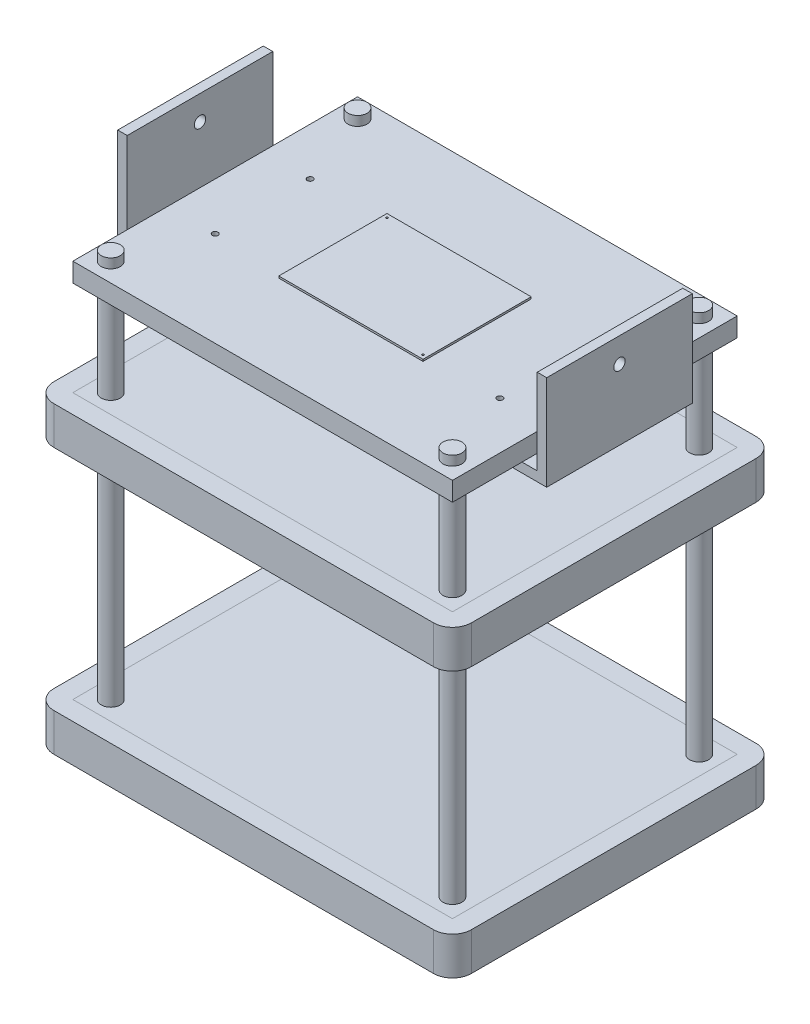
from build123d import *

# Parameters (mm, degrees)
SKETCH1_W            = 200
SKETCH1_H            = 150
BOSS_EXTRUDE1_DEPTH  = 10
SKETCH2_R            = 5
CUT_EXTRUDE1_DEPTH   = 10
SKETCH3_W            = 200
SKETCH3_H            = 150
SKETCH3_R            = 5
BOSS_EXTRUDE2_DEPTH  = 10
SKETCH4_W            = 200
SKETCH4_H            = 150
SKETCH4_R            = 5
BOSS_EXTRUDE3_DEPTH  = 10
BOSS_EXTRUDE13_START = 205
SKETCH21_R           = 5
BOSS_EXTRUDE13_DEPTH = 205
SKETCH22_R           = 5
BOSS_EXTRUDE14_DEPTH = 15
SKETCH23_R           = 1.5
CUT_EXTRUDE2_DEPTH   = 10
SKETCH27_W           = 76
SKETCH27_H           = 57
BOSS_EXTRUDE16_DEPTH = 1
SKETCH30_R           = 0.5
CUT_EXTRUDE3_DEPTH   = 30
SKETCH35_W           = 220
SKETCH35_H           = 170
SKETCH35_W_2         = 200
SKETCH35_H_2         = 150
BOSS_EXTRUDE19_DEPTH = 10
FILLET4_R            = 10
SKETCH39_W           = 220
SKETCH39_H           = 170
SKETCH39_W_2         = 200
SKETCH39_H_2         = 150
BOSS_EXTRUDE20_DEPTH = 10
FILLET5_R            = 10
SKETCH42_W           = 15
SKETCH42_H           = 20
SKETCH42_W_2         = 25
SKETCH42_H_2         = 50
SKETCH42_W_3         = 43.3
SKETCH42_H_3         = 43.3
BOSS_EXTRUDE23_DEPTH = 1
SKETCH46_W           = 30
SKETCH46_H           = 76.670556204
BOSS_EXTRUDE24_DEPTH = 5
SKETCH48_W           = 76.670556204
SKETCH48_H           = 50
BOSS_EXTRUDE25_DEPTH = 5
SKETCH49_R           = 3
CUT_EXTRUDE4_DEPTH   = 5
SKETCH54_W           = 76.670556204
SKETCH54_H           = 50
BOSS_EXTRUDE26_DEPTH = 5
CUT_EXTRUDE5_START   = -5
SKETCH55_R           = 3
CUT_EXTRUDE5_DEPTH   = 5


with BuildPart() as part:
    # Sketch1 → Boss-Extrude1 (new body)
    with BuildSketch(Plane(origin=(0, 0, 0), x_dir=(1, 0, 0), z_dir=(0, 1, 0))):
        Rectangle(SKETCH1_W, SKETCH1_H)
    extrude(amount=BOSS_EXTRUDE1_DEPTH)

    # Sketch2 → Cut-Extrude1 (cut)
    with BuildSketch(Plane(origin=(0, 10, 0), x_dir=(1, 0, 0), z_dir=(0, 1, 0))):
        with Locations((-90, 65)):
            Circle(SKETCH2_R)
        with Locations((90, 65)):
            Circle(SKETCH2_R)
        with Locations((90, -65)):
            Circle(SKETCH2_R)
        with Locations((-90, -65)):
            Circle(SKETCH2_R)
    extrude(amount=-CUT_EXTRUDE1_DEPTH, mode=Mode.SUBTRACT)



with BuildPart() as body_2:
    # Sketch3 → Boss-Extrude2 (new body)
    with BuildSketch(Plane(origin=(0, 140, 0), x_dir=(1, 0, 0), z_dir=(0, 1, 0))):
        Rectangle(SKETCH3_W, SKETCH3_H)
        with Locations((-90, 65)):
            Circle(SKETCH3_R, mode=Mode.SUBTRACT)
        with Locations((90, 65)):
            Circle(SKETCH3_R, mode=Mode.SUBTRACT)
        with Locations((-90, -65)):
            Circle(SKETCH3_R, mode=Mode.SUBTRACT)
        with Locations((90, -65)):
            Circle(SKETCH3_R, mode=Mode.SUBTRACT)
    extrude(amount=BOSS_EXTRUDE2_DEPTH)



with BuildPart() as body_3:
    # Sketch4 → Boss-Extrude3 (new body)
    with BuildSketch(Plane(origin=(0, 200, 0), x_dir=(1, 0, 0), z_dir=(0, 1, 0))):
        Rectangle(SKETCH4_W, SKETCH4_H)
        with Locations((-90, 65)):
            Circle(SKETCH4_R, mode=Mode.SUBTRACT)
        with Locations((90, 65)):
            Circle(SKETCH4_R, mode=Mode.SUBTRACT)
        with Locations((90, -65)):
            Circle(SKETCH4_R, mode=Mode.SUBTRACT)
        with Locations((-90, -65)):
            Circle(SKETCH4_R, mode=Mode.SUBTRACT)
    extrude(amount=BOSS_EXTRUDE3_DEPTH)


with BuildPart() as body_2_1:
    add(body_2.part)

    add(body_3.part)  # Boss-Extrude13 merges body 3
    # Sketch21 → Boss-Extrude13 (add)
    with BuildSketch(Plane(origin=(0, 10, 0), x_dir=(1, 0, 0), z_dir=(0, 1, 0)).offset(BOSS_EXTRUDE13_START)):
        with Locations((-90, -65)):
            Circle(SKETCH21_R)
        with Locations((-90, 65)):
            Circle(SKETCH21_R)
        with Locations((90, 65)):
            Circle(SKETCH21_R)
        with Locations((90, -65)):
            Circle(SKETCH21_R)
    extrude(amount=-BOSS_EXTRUDE13_DEPTH)


with BuildPart() as part_1:
    add(part.part)

    add(body_2_1.part)  # Boss-Extrude14 merges body 2
    # Sketch22 → Boss-Extrude14 (add)
    with BuildSketch(Plane(origin=(0, 10, 0), x_dir=(1, 0, 0), z_dir=(0, 1, 0))):
        with Locations((-90, 65)):
            Circle(SKETCH22_R)
        with Locations((-90, -65)):
            Circle(SKETCH22_R)
        with Locations((90, -65)):
            Circle(SKETCH22_R)
        with Locations((90, 65)):
            Circle(SKETCH22_R)
    extrude(amount=-BOSS_EXTRUDE14_DEPTH)

    # Sketch23 → Cut-Extrude2 (cut)
    with BuildSketch(Plane(origin=(0, 210, 0), x_dir=(1, 0, 0), z_dir=(0, 1, 0))):
        with Locations((-75, 25)):
            Circle(SKETCH23_R)
        with Locations((-75, -25)):
            Circle(SKETCH23_R)
        with Locations((75, -25)):
            Circle(SKETCH23_R)
        with Locations((75, 25)):
            Circle(SKETCH23_R)
    extrude(amount=-CUT_EXTRUDE2_DEPTH, mode=Mode.SUBTRACT)

    # Sketch27 → Boss-Extrude16 (add)
    with BuildSketch(Plane(origin=(0, 210, 0), x_dir=(1, 0, 0), z_dir=(0, 1, 0))):
        Rectangle(SKETCH27_W, SKETCH27_H)
    extrude(amount=BOSS_EXTRUDE16_DEPTH)

    # Sketch30 → Cut-Extrude3 (cut)
    with BuildSketch(Plane(origin=(0, 211, 0), x_dir=(1, 0, 0), z_dir=(0, 1, 0))):
        with Locations((-36, 26.5)):
            Circle(SKETCH30_R)
        with Locations((36, -26.5)):
            Circle(SKETCH30_R)
    extrude(amount=-CUT_EXTRUDE3_DEPTH, mode=Mode.SUBTRACT)

    # Sketch42 → Boss-Extrude23 (add)
    with BuildSketch(Plane.XZ.offset(-200)):
        Rectangle(SKETCH42_W, SKETCH42_H)
        with Locations((-58.240305189, 7.803312526)):
            Rectangle(SKETCH42_W_2, SKETCH42_H_2)
        with Locations((37.35, 2.211754737)):
            Rectangle(SKETCH42_W_3, SKETCH42_H_3)
    extrude(amount=BOSS_EXTRUDE23_DEPTH)

    # Sketch46 → Boss-Extrude24 (add)
    with BuildSketch(Plane(origin=(0, 200, 0), x_dir=(-1, 0, 0), z_dir=(0, -1, 0))):
        with Locations((-93, 0)):
            Rectangle(SKETCH46_W, SKETCH46_H)
        with Locations((93, 0)):
            Rectangle(SKETCH46_W, SKETCH46_H)
    extrude(amount=BOSS_EXTRUDE24_DEPTH)

    # Sketch48 → Boss-Extrude25 (add)
    with BuildSketch(Plane.ZY.offset(108)):
        with Locations((0, 220)):
            Rectangle(SKETCH48_W, SKETCH48_H)
    extrude(amount=BOSS_EXTRUDE25_DEPTH)

    # Sketch49 → Cut-Extrude4 (cut)
    with BuildSketch(Plane.ZY.offset(113)):
        with Locations((0, 232)):
            Circle(SKETCH49_R)
    extrude(amount=-CUT_EXTRUDE4_DEPTH, mode=Mode.SUBTRACT)

    # Sketch54 → Boss-Extrude26 (add)
    with BuildSketch(Plane(origin=(108, 0, 0), x_dir=(0, 0, -1), z_dir=(1, 0, 0))):
        with Locations((0, 220)):
            Rectangle(SKETCH54_W, SKETCH54_H)
    extrude(amount=BOSS_EXTRUDE26_DEPTH)

    # Sketch55 → Cut-Extrude5 (cut)
    with BuildSketch(Plane(origin=(113, 0, 0), x_dir=(0, 0, -1), z_dir=(1, 0, 0)).offset(CUT_EXTRUDE5_START)):
        with Locations((0, 232)):
            Circle(SKETCH55_R)
    extrude(amount=CUT_EXTRUDE5_DEPTH, mode=Mode.SUBTRACT)


with BuildPart() as body_2_2:
    # Sketch35 → Boss-Extrude19 (new, symmetric)
    with BuildSketch(Plane(origin=(0, 0, 0), x_dir=(-1, 0, 0), z_dir=(0, -1, 0))):
        Rectangle(SKETCH35_W, SKETCH35_H)
        Rectangle(SKETCH35_W_2, SKETCH35_H_2, mode=Mode.SUBTRACT)
    extrude(amount=BOSS_EXTRUDE19_DEPTH, both=True)

    # Fillet4
    fillet4_edges = [body_2_2.edges().sort_by_distance(p)[0] for p in [
        (110, 0, 85),
        (110, 0, -85),
        (-110, 0, 85),
        (-110, 0, -85),
    ]]
    fillet(fillet4_edges, radius=FILLET4_R)


with BuildPart() as body_3_2:
    # Sketch39 → Boss-Extrude20 (new, symmetric)
    with BuildSketch(Plane.XZ.offset(-140)):
        Rectangle(SKETCH39_W, SKETCH39_H)
        Rectangle(SKETCH39_W_2, SKETCH39_H_2, mode=Mode.SUBTRACT)
    extrude(amount=BOSS_EXTRUDE20_DEPTH, both=True)

    # Fillet5
    fillet5_edges = [body_3_2.edges().sort_by_distance(p)[0] for p in [
        (110, 140, 85),
        (110, 140, -85),
        (-110, 140, -85),
        (-110, 140, 85),
    ]]
    fillet(fillet5_edges, radius=FILLET5_R)


solid = Compound([part_1.part, body_2_2.part, body_3_2.part])
